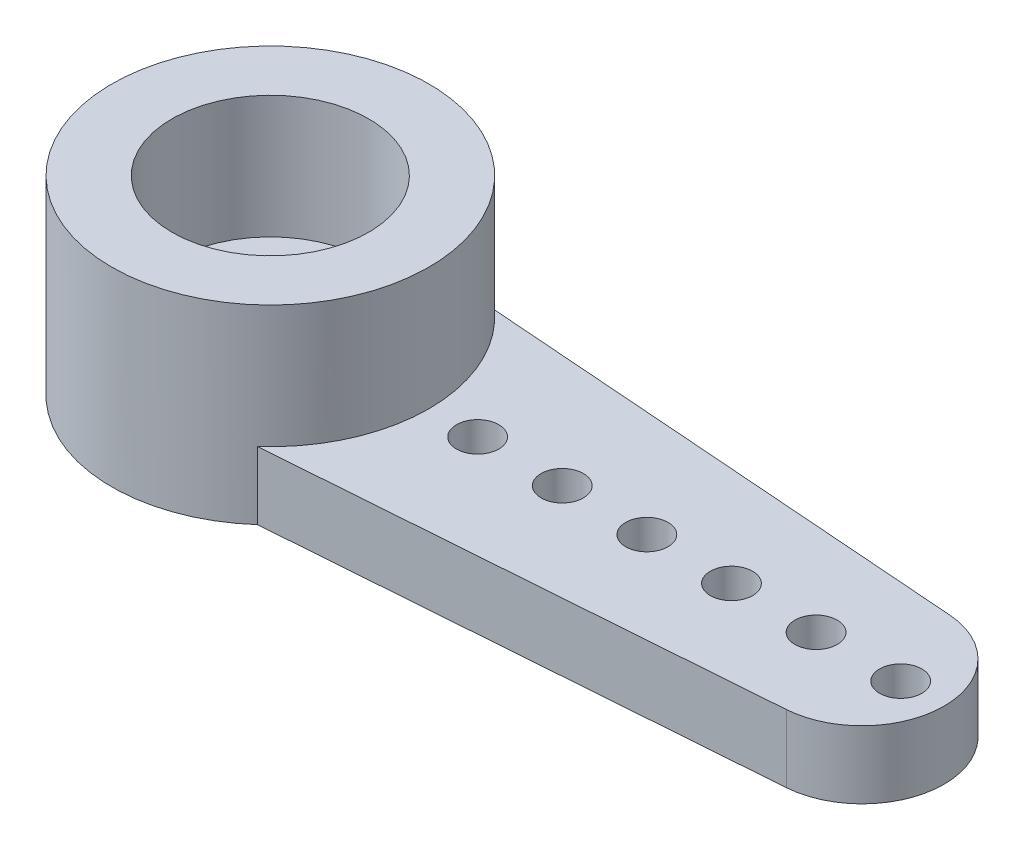
from build123d import *

# Parameters (mm, degrees)
SKETCH1_R               = 0.5
SKETCH1_R_2             = 1.5
BOSS_EXTRUDE1_DEPTH     = 1.6
SKETCH2_R               = 3.75
SKETCH2_R_2             = 2.325
BOSS_EXTRUDE2_DEPTH     = 2.9
FILLET1_START           = -1
FILLET1_DEPTH           = 4
FILLET2_START           = -1
FILLET2_DEPTH           = 4
SKETCH3_R               = 2.45
CUT_EXTRUDE1_DEPTH      = 0.8
ENL_V_START             = -10
ENL_V_MAT_EXTRU_1_DEPTH = 10


with BuildPart() as part:
    # Sketch1 → Boss-Extrude1 (new body)
    with BuildSketch(Plane(origin=(0, 0, 0), x_dir=(1, 0, 0), z_dir=(0, 1, 0))):
        with BuildLine():
            Line((2.494493937, 2.8), (14.9, 1.875))
            ThreePointArc((14.9, 1.875), (15.925, 0), (14.9, -1.875))
            Line((14.9, -1.875), (2.494493937, -2.8))
            ThreePointArc((2.494493937, -2.8), (0, -3.75), (-2.494493937, -2.8))
            Line((-2.494493937, -2.8), (-14.9, -1.875))
            ThreePointArc((-14.9, -1.875), (-15.925, 0), (-14.9, 1.875))
            Line((-14.9, 1.875), (-2.494493937, 2.8))
            ThreePointArc((-2.494493937, 2.8), (0, 3.75), (2.494493937, 2.8))
        make_face()
        with Locations(Location((4.9, 0, 0), (0, 0, 270))):
            Circle(SKETCH1_R, mode=Mode.SUBTRACT)
        with Locations(Location((6.9, 0, 0), (0, 0, 270))):
            Circle(SKETCH1_R, mode=Mode.SUBTRACT)
        with Locations(Location((8.9, 0, 0), (0, 0, 270))):
            Circle(SKETCH1_R, mode=Mode.SUBTRACT)
        with Locations(Location((10.9, 0, 0), (0, 0, 270))):
            Circle(SKETCH1_R, mode=Mode.SUBTRACT)
        with Locations(Location((12.9, 0, 0), (0, 0, 270))):
            Circle(SKETCH1_R, mode=Mode.SUBTRACT)
        with Locations(Location((14.9, 0, 0), (0, 0, 270))):
            Circle(SKETCH1_R, mode=Mode.SUBTRACT)
        with Locations(Location((-14.9, 0, 0), (0, 0, 90))):
            Circle(SKETCH1_R, mode=Mode.SUBTRACT)
        with Locations(Location((-12.9, 0, 0), (0, 0, 90))):
            Circle(SKETCH1_R, mode=Mode.SUBTRACT)
        with Locations(Location((-10.9, 0, 0), (0, 0, 90))):
            Circle(SKETCH1_R, mode=Mode.SUBTRACT)
        with Locations(Location((-8.9, 0, 0), (0, 0, 90))):
            Circle(SKETCH1_R, mode=Mode.SUBTRACT)
        with Locations(Location((-6.9, 0, 0), (0, 0, 90))):
            Circle(SKETCH1_R, mode=Mode.SUBTRACT)
        with Locations(Location((-4.9, 0, 0), (0, 0, 90))):
            Circle(SKETCH1_R, mode=Mode.SUBTRACT)
        with Locations(Location((0, 0, 0), (0, 0, 270))):
            Circle(SKETCH1_R_2, mode=Mode.SUBTRACT)
    extrude(amount=BOSS_EXTRUDE1_DEPTH)

    # Sketch2 → Boss-Extrude2 (add)
    with BuildSketch(Plane(origin=(0, 1.6, 0), x_dir=(1, 0, 0), z_dir=(0, 1, 0))):
        with Locations(Location((0, 0, 0), (0, 0, 48.302453397))):
            Circle(SKETCH2_R)
        with Locations(Location((0, 0, 0), (0, 0, 270))):
            Circle(SKETCH2_R_2, mode=Mode.SUBTRACT)
    extrude(amount=BOSS_EXTRUDE2_DEPTH)

    # Fillet1: read off the stored shape, not the designer's step
    # Fillet1 outline → Fillet1 (cut)
    with BuildSketch(Plane(origin=(0, 0, 0), x_dir=(1, 0, 0), z_dir=(0, 1, 0)).offset(FILLET1_START)):
        with BuildLine():
            Line((-14.9, -1.875), (-14.131406802, -1.932309126))
            add(Edge.make_bspline(
                [(-14.131406802, -1.932309126), (-15.060349902, -1.863043724), (-15.925, -1.199048162), (-15.925, 0)],
                knots=[0, 0, 0, 0, 0.5, 0.5, 0.5, 0.5], degree=3, weights=[1, 0.691452416, 0.537178624, 0.537178624]))
            ThreePointArc((-15.925, 0), (-15.652023077, -1.068439282), (-14.9, -1.875))
        make_face()
        with BuildLine():
            ThreePointArc((-14.9, 1.875), (-15.652023077, 1.068439282), (-15.925, 0))
            add(Edge.make_bspline(
                [(-15.925, 0), (-15.925, 1.199048162), (-15.060349902, 1.863043724), (-14.131406802, 1.932309126)],
                knots=[0.5, 0.5, 0.5, 0.5, 1, 1, 1, 1], degree=3, weights=[0.537178624, 0.537178624, 0.691452416, 1]))
            Line((-14.131406802, 1.932309126), (-14.9, 1.875))
        make_face()
    extrude(amount=FILLET1_DEPTH, mode=Mode.SUBTRACT)

    # Fillet2: read off the stored shape, not the designer's step
    # Fillet2 outline → Fillet2 (cut)
    with BuildSketch(Plane(origin=(0, 0, 0), x_dir=(1, 0, 0), z_dir=(0, 1, 0)).offset(FILLET2_START)):
        with BuildLine():
            Line((14.9, 1.875), (14.131406802, 1.932309126))
            add(Edge.make_bspline(
                [(14.131406802, 1.932309126), (15.060349902, 1.863043724), (15.925, 1.199048162), (15.925, 0)],
                knots=[0, 0, 0, 0, 0.5, 0.5, 0.5, 0.5], degree=3, weights=[1, 0.691452416, 0.537178624, 0.537178624]))
            ThreePointArc((15.925, 0), (15.652023077, 1.068439282), (14.9, 1.875))
        make_face()
        with BuildLine():
            ThreePointArc((14.9, -1.875), (15.652023077, -1.068439282), (15.925, 0))
            add(Edge.make_bspline(
                [(15.925, 0), (15.925, -1.199048162), (15.060349902, -1.863043724), (14.131406802, -1.932309126)],
                knots=[0.5, 0.5, 0.5, 0.5, 1, 1, 1, 1], degree=3, weights=[0.537178624, 0.537178624, 0.691452416, 1]))
            Line((14.131406802, -1.932309126), (14.9, -1.875))
        make_face()
    extrude(amount=FILLET2_DEPTH, mode=Mode.SUBTRACT)

    # Sketch3 → Cut-Extrude1 (cut)
    with BuildSketch(Plane.XZ):
        with Locations(Location((0, 0, 0), (0, 0, 270))):
            Circle(SKETCH3_R)
    extrude(amount=-CUT_EXTRUDE1_DEPTH, mode=Mode.SUBTRACT)

    # Esquisse1 → Enlèv. mat.-Extru.1 (cut)
    with BuildSketch(Plane(origin=(0, 1.6, 0), x_dir=(1, 0, 0), z_dir=(0, 1, 0)).offset(ENL_V_START)):
        with BuildLine():
            Line((-2.494493937, 2.8), (-5.326259476, 9.645712634))
            Line((-5.326259476, 9.645712634), (-26.688602042, 9.645712634))
            Line((-26.688602042, 9.645712634), (-23.449621421, -3.244588312))
            Line((-23.449621421, -3.244588312), (-9.542304725, -12.289889455))
            Line((-9.542304725, -12.289889455), (-2.045012757, -5.407049631))
            Line((-2.045012757, -5.407049631), (-2.494493937, -2.8))
            ThreePointArc((-2.494493937, -2.8), (-3.75, 0), (-2.494493937, 2.8))
        make_face()
    extrude(amount=ENL_V_MAT_EXTRU_1_DEPTH, mode=Mode.SUBTRACT)


solid = part.part
